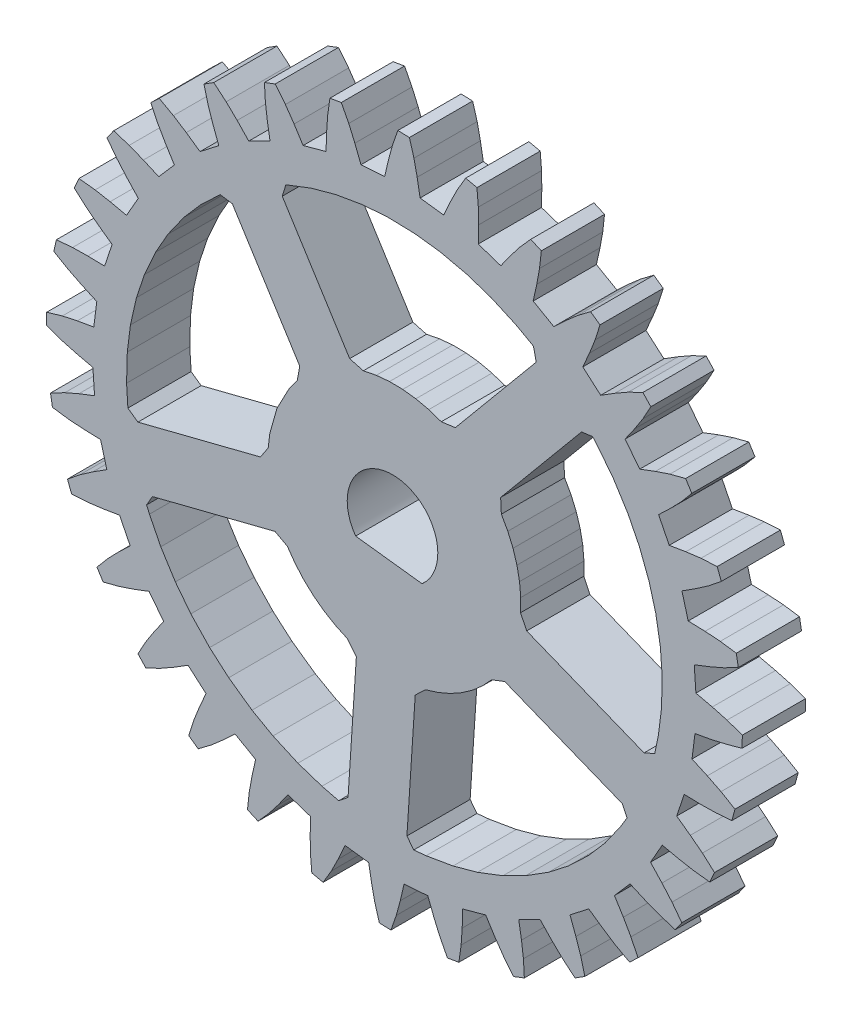
from build123d import *

# Parameters (mm, degrees)
EXTRUDE_1_DEPTH      = 2
EXTRUDE_1_DEPTH_BACK = 1


with BuildPart() as part:
    # Эскиз1 → Бобышка-Вытянуть1 (new, two sides: drawn at the far end of the back side and taken through both)
    with BuildSketch(Plane.XY.offset(-EXTRUDE_1_DEPTH_BACK)):
        Polygon((-34.11788559, -63.584106445), (-34.298080444, -64.360931396), (-35.424102783, -64.440612793), (-35.713062286, -63.698516846), (-36.002017975, -63.033485413), (-36.356723785, -62.349716187), (-36.897735596, -62.442459106), (-37.004451752, -63.20533371), (-37.055412292, -63.928630829), (-37.080596924, -64.72567749), (-38.169433594, -65.023513794), (-38.597618103, -64.352043152), (-39.010761261, -63.756168365), (-39.492050171, -63.154735565), (-40.004573822, -63.351242065), (-39.960411072, -64.120277405), (-39.869285583, -64.839614868), (-39.738487244, -65.626266479), (-40.748298645, -66.13079834), (-41.299247742, -65.555763245), (-41.820705414, -65.051940918), (-42.410079956, -64.555953979), (-42.874420166, -64.848678589), (-42.681072235, -65.594314575), (-42.45136261, -66.282058716), (-42.16960907, -67.028076172), (-43.061588287, -67.719917297), (-43.714138031, -67.263420105), (-44.323863983, -66.871002197), (-44.9986763, -66.499534607), (-45.396987915, -66.877212524), (-45.061889648, -67.570808411), (-44.702419281, -68.200523376), (-44.280540466, -68.877235413), (-45.02040863, -69.729797363), (-45.749477386, -69.409378052), (-46.424045563, -69.143455505), (-47.158359528, -68.910774231), (-47.475334167, -69.358909607), (-47.011360168, -69.973800659), (-46.535949707, -70.521286011), (-45.990158081, -71.10269165), (-46.549484253, -72.083213806), (-47.327049255, -71.911186218), (-48.040534973, -71.781974792), (-48.806137085, -71.697021484), (-49.029594421, -72.198379517), (-48.454574585, -72.7109375), (-47.8814888, -73.155158997), (-47.232757568, -73.618911743), (-47.590045929, -74.689712524), (-48.386234283, -74.672683716), (-49.111217499, -74.685150146), (-49.878681183, -74.751190186), (-50.000030518, -75.286514282), (-49.3360672, -75.677047729), (-48.687332153, -76.000923157), (-47.960594177, -76.329200745), (-48.102111816, -77.449134827), (-48.886322021, -77.587760925), (-49.594944, -77.741424561), (-50.334777832, -77.955924988), (-50.34936142, -78.504631042), (-49.621967316, -78.758125305), (-48.92250824, -78.94921875), (-48.145690918, -79.12940979), (-48.066001892, -80.255432129), (-48.808097839, -80.544387817), (-49.473125458, -80.833343506), (-50.156898499, -81.188056946), (-50.064155579, -81.729064941), (-49.301280975, -81.835784912), (-48.577987671, -81.886741638), (-47.780937195, -81.91192627), (-47.483104706, -83.000762939), (-48.154571533, -83.428947449), (-48.750442505, -83.842086792), (-49.35187912, -84.323379517), (-49.15537262, -84.835899353), (-48.38633728, -84.791740417), (-47.666996002, -84.700614929), (-46.880348206, -84.569816589), (-46.375816345, -85.579627991), (-46.950847626, -86.130577087), (-47.454673767, -86.652030945), (-47.950653076, -87.241409302), (-47.657936096, -87.705749512), (-46.91229248, -87.512397766), (-46.224552155, -87.282691956), (-45.479496002, -87.001449585), (-44.786712646, -87.892883301), (-45.243209839, -88.545433044), (-45.635627747, -89.155158997), (-46.007095337, -89.829971313), (-45.629421234, -90.228279114), (-44.935825348, -89.893180847), (-44.306106567, -89.533714294), (-43.629394531, -89.111831665), (-42.776832581, -89.851699829), (-43.097251892, -90.5807724), (-43.363178253, -91.255340576), (-43.595859528, -91.989654541), (-43.147735596, -92.306632996), (-42.532836914, -91.842658997), (-41.985351562, -91.367248535), (-41.403945923, -90.82144928), (-40.423423767, -91.380783081), (-40.595451355, -92.158348083), (-40.724666595, -92.871833801), (-40.809619904, -93.637435913), (-40.308265686, -93.860900879), (-39.795703888, -93.285881042), (-39.351482391, -92.712791443), (-38.88772583, -92.064056396), (-37.816925049, -92.421348572), (-37.833950043, -93.217536926), (-37.821491241, -93.942520142), (-37.755451202, -94.709983826), (-37.22013092, -94.831344604), (-36.829601288, -94.167373657), (-36.505718231, -93.518638611), (-36.177436829, -92.791900635), (-35.057510376, -92.933418274), (-34.918876648, -93.717636108), (-34.765216827, -94.426254272), (-34.55072403, -95.16608429), (-34.00201416, -95.180679321), (-33.748516083, -94.453277588), (-33.557426453, -93.753822327), (-33.377231598, -92.976997375), (-32.251209259, -92.897315979), (-31.962249756, -93.639419556), (-31.673297882, -94.304443359), (-31.318588257, -94.988212585), (-30.777578354, -94.895477295), (-30.670862198, -94.132598877), (-30.619897842, -93.409301758), (-30.594717026, -92.612251282), (-29.505878448, -92.314422607), (-29.077693939, -92.98588562), (-28.664552689, -93.581771851), (-28.183261871, -94.183197021), (-27.67073822, -93.986701965), (-27.714902878, -93.217658997), (-27.806026459, -92.498321533), (-27.936824799, -91.711669922), (-26.927013397, -91.207145691), (-26.376060486, -91.782173157), (-25.854606628, -92.286003113), (-25.265232086, -92.781982422), (-24.800891876, -92.489265442), (-24.9942379, -91.743621826), (-25.223949432, -91.055877686), (-25.505701065, -90.309867859), (-24.61371994, -89.618026733), (-23.961172104, -90.074523926), (-23.351444244, -90.466941833), (-22.676633835, -90.838409424), (-22.27832222, -90.460731506), (-22.613420486, -89.76713562), (-22.972888947, -89.137420654), (-23.394767761, -88.460708618), (-22.654899597, -87.608146667), (-21.925830841, -87.928565979), (-21.299468994, -88.166069809), (-20.516946793, -88.4271698), (-20.199970245, -87.979042053), (-20.663944244, -87.364151001), (-21.139356613, -86.816665649), (-21.685150146, -86.23526001), (-21.125823975, -85.254730225), (-20.34825325, -85.426765442), (-19.634767532, -85.555976868), (-18.869169235, -85.640930176), (-18.645708084, -85.139572144), (-19.220726013, -84.627006531), (-19.793811798, -84.182792664), (-20.442544937, -83.719039917), (-20.085256577, -82.648239136), (-19.289066315, -82.665260315), (-18.564083099, -82.652801514), (-17.82360652, -82.594420971), (-17.675262451, -82.051437378), (-18.339229584, -81.660903931), (-18.987966537, -81.337028503), (-19.714708328, -81.008750916), (-19.573188782, -79.888816833), (-18.788974762, -79.750183105), (-18.053325653, -79.57700265), (-17.340518951, -79.382026672), (-17.325929642, -78.833320618), (-18.053325653, -78.579826355), (-18.752784729, -78.38873291), (-19.529605865, -78.20854187), (-19.609292984, -77.082519531), (-18.867193222, -76.793563843), (-18.202163696, -76.504608154), (-17.51839447, -76.149902344), (-17.611133575, -75.608886719), (-18.374008179, -75.502166748), (-19.097307205, -75.451210022), (-19.894355774, -75.426025391), (-20.192188263, -74.337188721), (-19.520721436, -73.909004211), (-18.924840927, -73.495864868), (-18.323410034, -73.014572144), (-18.51991272, -72.502052307), (-19.288949966, -72.546211243), (-20.008293152, -72.637336731), (-20.794940948, -72.768135071), (-21.299468994, -71.758323669), (-20.724437714, -71.207374573), (-20.220611572, -70.685920715), (-19.724632263, -70.096542358), (-20.017345428, -69.632202148), (-20.762989044, -69.825546265), (-21.450733185, -70.055259705), (-22.196746826, -70.337013245), (-22.888587952, -69.445030212), (-22.432090759, -68.792488098), (-22.039672852, -68.182754517), (-21.668205261, -67.507949829), (-22.045886993, -67.109634399), (-22.73948288, -67.444732666), (-23.369194031, -67.804199219), (-24.045907974, -68.226081848), (-24.898471832, -67.486213684), (-24.578052521, -66.757148743), (-24.31212616, -66.082572937), (-24.079446793, -65.348258972), (-24.527576447, -65.031288147), (-25.142469406, -65.495262146), (-25.689954758, -65.970672607), (-26.271360397, -66.516464233), (-27.251882553, -65.957138062), (-27.079854965, -65.179573059), (-26.950641632, -64.466079712), (-26.865688324, -63.700485229), (-27.367048264, -63.477027893), (-27.879608154, -64.052047729), (-28.323825836, -64.6251297), (-28.787582397, -65.273864746), (-29.858385086, -64.916572571), (-29.841358185, -64.120384216), (-29.853820801, -63.395401001), (-29.919862747, -62.627937317), (-30.455181122, -62.506584167), (-30.845714569, -63.170547485), (-31.169591904, -63.819286346), (-31.497873306, -64.546028137), (-32.617805481, -64.404510498), (-32.756435394, -63.620292664), (-32.910095215, -62.911670685), (-33.124591827, -62.171836853), (-33.673301697, -62.157253265), (-33.926795959, -62.884651184), align=None)
        Polygon((-45.595066071, -83.504745483), (-45.319366455, -83.02444458), (-39.503406525, -81.549789429), (-38.913288116, -81.868629456), (-38.551029205, -82.381652832), (-38.137126923, -82.853996277), (-37.676120758, -83.280487061), (-37.173042297, -83.656463623), (-36.63343811, -83.977783203), (-36.06319809, -84.240936279), (-35.642566681, -84.763404846), (-36.037319183, -90.750411987), (-36.478687286, -91.105033875), (-37.27665329, -90.908035278), (-38.414592743, -90.529930115), (-39.598297119, -90.001945496), (-40.595451355, -89.441072106), (-41.698562622, -88.660339355), (-42.605190277, -87.875549316), (-43.496742249, -86.934768677), (-44.232521057, -85.987998962), (-44.923709869, -84.891578674), (-45.460998535, -83.819572449), align=None, mode=Mode.SUBTRACT)
        Polygon((-33.243385315, -90.934638977), (-32.848632812, -84.947639465), (-32.36302948, -84.484924316), (-31.763195038, -84.298934937), (-31.186067581, -84.051254272), (-30.637989044, -83.744606018), (-30.124946594, -83.382324219), (-29.652606964, -82.968421936), (-29.22611618, -82.507415771), (-28.599233627, -82.268821716), (-23.027242661, -84.494346619), (-22.799194336, -84.975639343), (-23.097496033, -85.471923828), (-23.846265793, -86.529876709), (-24.631055832, -87.436508179), (-25.571836472, -88.328056335), (-26.518421173, -89.064155579), (-27.615056992, -89.7550354), (-28.68706131, -90.292327881), (-29.897411346, -90.755989075), (-31.053634644, -91.073814392), (-32.331184387, -91.292442322), (-32.919406891, -91.349182129), align=None, mode=Mode.SUBTRACT)
        Polygon((-46.007530212, -80.310325623), (-46.483852386, -79.970947266), (-46.547279358, -78.979438782), (-46.512466431, -77.683792114), (-46.363639832, -76.49394989), (-46.076725006, -75.229980469), (-45.698627472, -74.092041016), (-45.170639038, -72.908332825), (-44.57780838, -71.866020203), (-43.829036713, -70.808067322), (-43.044250488, -69.901435852), (-42.103469849, -69.009887695), (-41.527999878, -69.095115662), (-38.328304291, -74.17073822), (-38.449169159, -74.830482483), (-38.825138092, -75.33354187), (-39.409622192, -76.443389893), (-39.750587463, -77.650527954), (-39.824645996, -78.274169922), (-40.191562653, -78.835670471), align=None, mode=Mode.SUBTRACT)
        with BuildLine():
            Line((-32.525254799, -80.210219675), (-35.677111588, -79.828383603))
            ThreePointArc((-35.677111588, -79.828383603), (-33.668221785, -76.445431969), (-32.525254799, -80.210219675))
        make_face(mode=Mode.SUBTRACT)
        Polygon((-21.483333588, -81.667739868), (-21.988658905, -81.894088745), (-27.560646057, -79.668563843), (-27.850654602, -79.063774109), (-27.842185974, -78.435798645), (-27.899400711, -77.810379028), (-28.021677017, -77.194366455), (-28.207674026, -76.594512939), (-28.455354691, -76.017379761), (-28.762004852, -75.469306946), (-28.795221329, -74.799346924), (-24.956771851, -70.187805176), (-24.430521011, -70.116943359), (-24.178560257, -70.403152466), (-23.442459106, -71.349731445), (-22.75157547, -72.446372986), (-22.214286804, -73.518371582), (-21.750621796, -74.728721619), (-21.432796478, -75.88494873), (-21.214168549, -77.162490845), (-21.128017426, -78.358505249), (-21.162826538, -79.654159546), (-21.311660767, -80.843994141), align=None, mode=Mode.SUBTRACT)
        Polygon((-35.95967865, -72.67755127), (-39.159374237, -67.601921082), (-38.988246918, -67.045608521), (-37.777900696, -66.581947327), (-36.621673584, -66.264122009), (-35.344127655, -66.04549408), (-34.148113251, -65.959335327), (-32.852462769, -65.994148254), (-31.662622452, -66.142982483), (-30.398654938, -66.429893494), (-29.26071167, -66.807991028), (-28.077007294, -67.335975647), (-27.23733902, -67.803100586), (-27.108823776, -68.396522522), (-30.947273254, -73.00806427), (-31.61207962, -73.096992493), (-32.206699371, -72.894882202), (-32.819190979, -72.756027222), (-33.442840576, -72.68196106), (-34.070812225, -72.673492432), (-34.696231842, -72.730705261), (-35.312244415, -72.852981567), align=None, mode=Mode.SUBTRACT)
    extrude(amount=EXTRUDE_1_DEPTH + EXTRUDE_1_DEPTH_BACK)


solid = part.part
